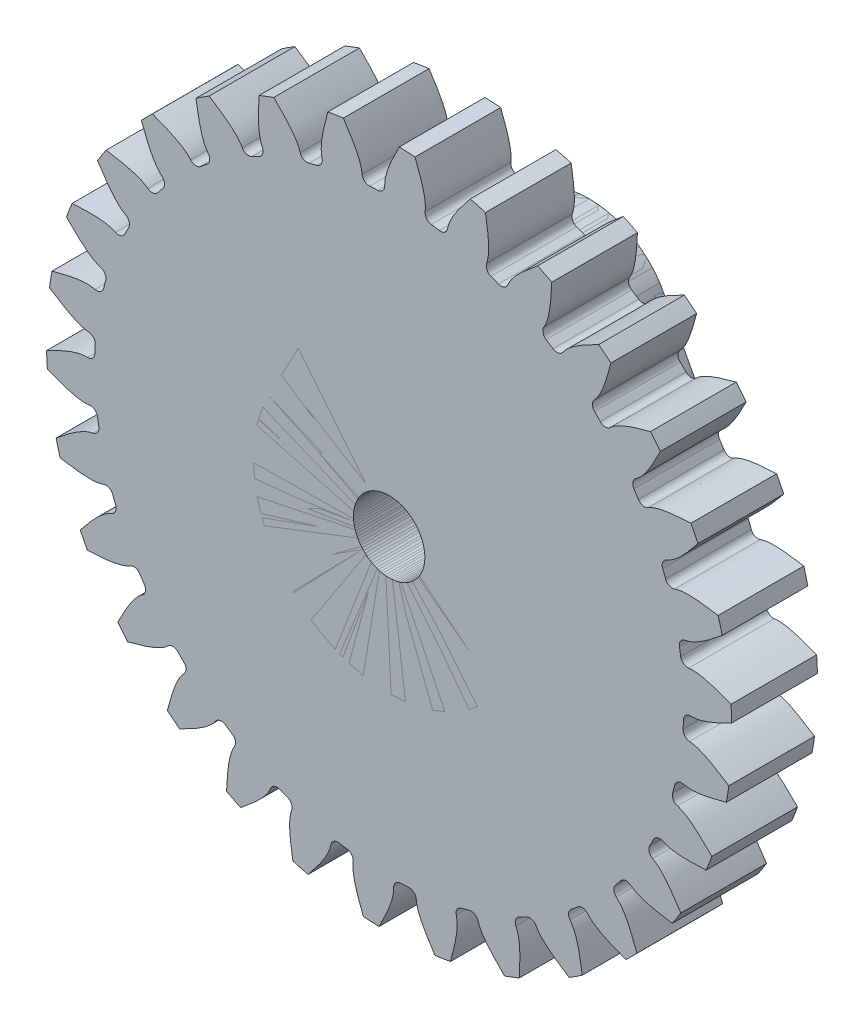
from build123d import *

# Parameters (mm, degrees)
ESQUISSE1_R                        = 20.625
BASE_EXTRUSION_DEPTH               = 10.5
BOSS_EXTRU_1_DEPTH                 = 10.5
CONG_1_R                           = 0.5
R_P_TITION_CIRCULAIRE1_COUNT       = 30
CONG_1_OF_R_P_TITION_CIRCULAIRE1_R = 0.5
ESQUISSE4_R                        = 30.232432916
ENL_V_MAT_EXTRU_3_DEPTH            = 4.5
BOSS_EXTRU_2_DEPTH                 = 8
ESQUISSE7_R                        = 6
BOSS_EXTRU_3_DEPTH                 = 0.5
ESQUISSE8_R                        = 2.5
ENL_V_MAT_EXTRU_4_DEPTH            = 37.895220109
EXTRUSION4_DEPTH                   = 14
ESQUISSE12_R                       = 2.5
ENL_V_MAT_EXTRU_5_DEPTH            = 37.89522007


# Read off the part's stored shape, not the designer's step: Boss.-Extru.1
with BuildPart() as part:
    # Esquisse1 → Base-Extrusion (new body)
    with BuildSketch(Plane.XY):
        with Locations(Location((0, 0, 0), (0, 0, 180))):
            Circle(ESQUISSE1_R)
    extrude(amount=BASE_EXTRUSION_DEPTH)

    # Boss.-Extru.1 outline → Boss.-Extru.1 (add)
    with BuildSketch(Plane.XY):
        with BuildLine():
            ThreePointArc((20.484465348, 2.403602385), (20.596798751, 1.078195813), (20.623464173, -0.251695283))
            add(Edge.make_bspline(
                [(20.623464173, -0.251695283), (20.794729, -0.290079683), (21.428539551, -0.374522367), (22.605430403, -0.003709182), (23.503486226, 0.454838834), (23.989698857, 0.703099389)],
                knots=[0.322166309, 0.322166309, 0.322166309, 0.322166309, 0.421730367, 0.686921466, 1, 1, 1, 1], degree=3))
            ThreePointArc((23.989698857, 0.703099389), (23.967184001, 1.254627855), (23.931991064, 1.805492653))
            add(Edge.make_bspline(
                [(23.931991064, 1.805492653), (23.422515147, 2.001631166), (22.481491026, 2.363907507), (21.272316213, 2.609815554), (20.65078642, 2.459658643), (20.484465348, 2.403602385)],
                knots=[0, 0, 0, 0, 0.313078534, 0.578269633, 0.677833691, 0.677833691, 0.677833691, 0.677833691], degree=3))
        make_face()
    boss_extru_1 = extrude(amount=BOSS_EXTRU_1_DEPTH)

    # Congé1
    cong_1_edges = [part.edges().sort_by_distance(p)[0] for p in [
        (20.623464173, -0.251695283, 5.25),
        (20.484465348, 2.403602385, 5.25),
    ]]
    fillet(cong_1_edges, radius=CONG_1_R)

    # Répétition circulaire1: Boss.-Extru.1 ×30 about axis
    r_p_tition_circulaire1_axis = Axis((0, 0, -50), (0, 0, 1))
    for i in range(1, R_P_TITION_CIRCULAIRE1_COUNT):
        add(boss_extru_1.rotate(r_p_tition_circulaire1_axis, i * 360 / R_P_TITION_CIRCULAIRE1_COUNT))

    # Congé1 of Répétition circulaire1
    cong_1_of_r_p_tition_circulaire1_edges = [part.edges().sort_by_distance(p)[0] for p in [
        (20.225122391, 4.04166417, 5.25),
        (19.537093597, 6.610037732, 5.25),
        (18.942845711, 8.158383504, 5.25),
        (17.735857106, 10.527582712, 5.25),
        (16.832675774, 11.918542331, 5.25),
        (15.159478553, 13.98502181, 5.25),
        (13.986837134, 15.157803666, 5.25),
        (11.920558044, 16.831248347, 5.25),
        (10.529706596, 17.734596246, 5.25),
        (8.160651948, 18.941868567, 5.25),
        (6.612377351, 19.53630187, 5.25),
        (4.044086202, 20.224638237, 5.25),
        (2.406055487, 20.484177357, 5.25),
        (-0.249225516, 20.623494167, 5.25),
        (-1.905422547, 20.536796, 5.25),
        (-4.531644883, 20.12100444, 5.25),
        (-6.133624473, 19.69185811, 5.25),
        (-8.616009624, 18.739130267, 5.25),
        (-10.093757577, 17.986291529, 5.25),
        (-12.3238134, 16.538266182, 5.25),
        (-13.61274504, 15.494637701, 5.25),
        (-15.493007394, 13.614600505, 5.25),
        (-16.536790223, 12.325793853, 5.25),
        (-17.985082621, 10.095911455, 5.25),
        (-18.738098322, 8.618253669, 5.25),
        (-19.691123436, 6.13598263, 5.25),
        (-20.120461608, 4.534054444, 5.25),
        (-20.536567668, 1.90788192, 5.25),
        (-20.623464173, 0.251695283, 5.25),
        (-20.484465348, -2.403602385, 5.25),
        (-20.225122391, -4.04166417, 5.25),
        (-19.537093597, -6.610037732, 5.25),
        (-18.942845711, -8.158383504, 5.25),
        (-17.735857106, -10.527582712, 5.25),
        (-16.832675774, -11.918542331, 5.25),
        (-15.159478553, -13.98502181, 5.25),
        (-13.986837134, -15.157803666, 5.25),
        (-11.920558044, -16.831248347, 5.25),
        (-10.529706596, -17.734596246, 5.25),
        (-8.160651948, -18.941868567, 5.25),
        (-6.612377351, -19.53630187, 5.25),
        (-4.044086202, -20.224638237, 5.25),
        (-2.406055487, -20.484177357, 5.25),
        (0.249225516, -20.623494167, 5.25),
        (1.905422547, -20.536796, 5.25),
        (4.531644883, -20.12100444, 5.25),
        (6.133624473, -19.69185811, 5.25),
        (8.616009624, -18.739130267, 5.25),
        (10.093757577, -17.986291529, 5.25),
        (12.3238134, -16.538266182, 5.25),
        (13.61274504, -15.494637701, 5.25),
        (15.493007394, -13.614600505, 5.25),
        (16.536790223, -12.325793853, 5.25),
        (17.985082621, -10.095911455, 5.25),
        (18.738098322, -8.618253669, 5.25),
        (19.691123436, -6.13598263, 5.25),
        (20.120461608, -4.534054444, 5.25),
        (20.536567668, -1.90788192, 5.25),
    ]]
    fillet(cong_1_of_r_p_tition_circulaire1_edges, radius=CONG_1_OF_R_P_TITION_CIRCULAIRE1_R)

    # Esquisse4 → Enlèv. mat.-Extru.3 (cut)
    with BuildSketch(Plane.XY.offset(10.5)):
        Circle(ESQUISSE4_R)
    extrude(amount=-ENL_V_MAT_EXTRU_3_DEPTH, mode=Mode.SUBTRACT)

    # Esquisse6 → Boss.-Extru.2 (add)
    with BuildSketch(Plane(origin=(0, 0, 0), x_dir=(-1, 0, 0), z_dir=(0, 0, -1))):
        with BuildLine():
            Line((4.949679425, 10.891264306), (8.284023668, 4.650263635))
            ThreePointArc((8.284023668, 4.650263635), (0, -9.5), (-8.284023668, 4.650263635))
            Line((-8.284023668, 4.650263635), (-4.949679425, 10.891264306))
            ThreePointArc((-4.949679425, 10.891264306), (0, 13.5), (4.949679425, 10.891264306))
        make_face()
    extrude(amount=BOSS_EXTRU_2_DEPTH)

    # Esquisse7 → Boss.-Extru.3 (add)
    with BuildSketch(Plane(origin=(0, 0, -8), x_dir=(-1, 0, 0), z_dir=(0, 0, -1))):
        Circle(ESQUISSE7_R)
    extrude(amount=BOSS_EXTRU_3_DEPTH)

    # Esquisse8 → Enlèv. mat.-Extru.4 (cut, through all)
    with BuildSketch(Plane(origin=(0, 0, -8.5), x_dir=(-1, 0, 0), z_dir=(0, 0, -1))):
        Circle(ESQUISSE8_R)
    extrude(amount=-ENL_V_MAT_EXTRU_4_DEPTH, mode=Mode.SUBTRACT)


with BuildPart() as body_2:
    # Esquisse10 → Extrusion4 (new, through all)
    with BuildSketch(Plane(origin=(0, 0, -8), x_dir=(-1, 0, 0), z_dir=(0, 0, -1))):
        with BuildLine():
            add(Edge.make_bspline(
                [(0, 13.5), (0.522948204, 13.499942724), (1.518709066, 13.368589198), (2.884965814, 12.825438234), (3.981259075, 12.043302193), (4.842089707, 11.141356304), (5.379873513, 10.071441657), (5.978322647, 8.970715134), (6.571652025, 7.853980259), (7.184549968, 6.709652906), (7.737717778, 5.667846434), (8.368589633, 4.508198797), (8.968640309, 3.275998108), (9.349509227, 1.86337052), (9.527531437, 0.415938203), (9.483329124, -1.048094458), (9.199265188, -2.518279094), (8.664440064, -4.006279989), (7.897239347, -5.363123578), (6.946023473, -6.527777187), (6.100544426, -7.305967577), (5.143864313, -8.015841378), (4.11812407, -8.598987944), (2.831117874, -9.098695706), (1.48990751, -9.420226835), (0.072456786, -9.536703191), (-1.416621218, -9.431478794), (-2.907034448, -9.092521218), (-4.253108437, -8.533211777), (-5.509606582, -7.779780761), (-6.499706457, -6.972552972), (-7.439181591, -5.954267231), (-8.136751542, -4.958944216), (-8.744769574, -3.782377515), (-9.199318646, -2.518265641), (-9.452369336, -1.208554674), (-9.519208279, -0.006264547), (-9.458982299, 1.101380119), (-9.266100356, 2.190201448), (-8.902872489, 3.413358594), (-8.368474005, 4.508213438), (-7.802308415, 5.548656925), (-7.296609121, 6.499712378), (-6.752155261, 7.516204694), (-6.198598286, 8.557168639), (-5.658269155, 9.554497115), (-5.140314811, 10.579726648), (-4.499410094, 11.543891518), (-3.677727567, 12.271256035), (-2.851549207, 12.809047786), (-2.067340514, 13.152745249), (-1.109827439, 13.425338946), (-0.449200996, 13.500049199), (0, 13.5)],
                knots=[0, 0, 0, 0, 0.023963424, 0.04563303, 0.0668652, 0.085452804, 0.102224039, 0.121564707, 0.143109738, 0.160298343, 0.181217644, 0.197294953, 0.220985486, 0.24397686, 0.26414154, 0.287823526, 0.31095416, 0.332652318, 0.360221783, 0.38211056, 0.401499257, 0.412847822, 0.436808845, 0.455430041, 0.476126095, 0.499965075, 0.520470592, 0.544499941, 0.56987289, 0.587079746, 0.611687281, 0.628248369, 0.650626483, 0.667285006, 0.688983164, 0.712113798, 0.728302232, 0.744205045, 0.762975396, 0.778980809, 0.802671342, 0.81874865, 0.833437022, 0.852154938, 0.871731622, 0.88761189, 0.904255324, 0.924556235, 0.9402972, 0.954313923, 0.969729689, 0.979415947, 1, 1, 1, 1], degree=3))
        make_face()
    extrude(amount=-EXTRUSION4_DEPTH)

    # Esquisse12 → Enlèv. mat.-Extru.5 (cut, through all)
    with BuildSketch(Plane.XY.offset(6)):
        Circle(ESQUISSE12_R)
    extrude(amount=-ENL_V_MAT_EXTRU_5_DEPTH, mode=Mode.SUBTRACT)


solid = Compound([part.part, body_2.part])
